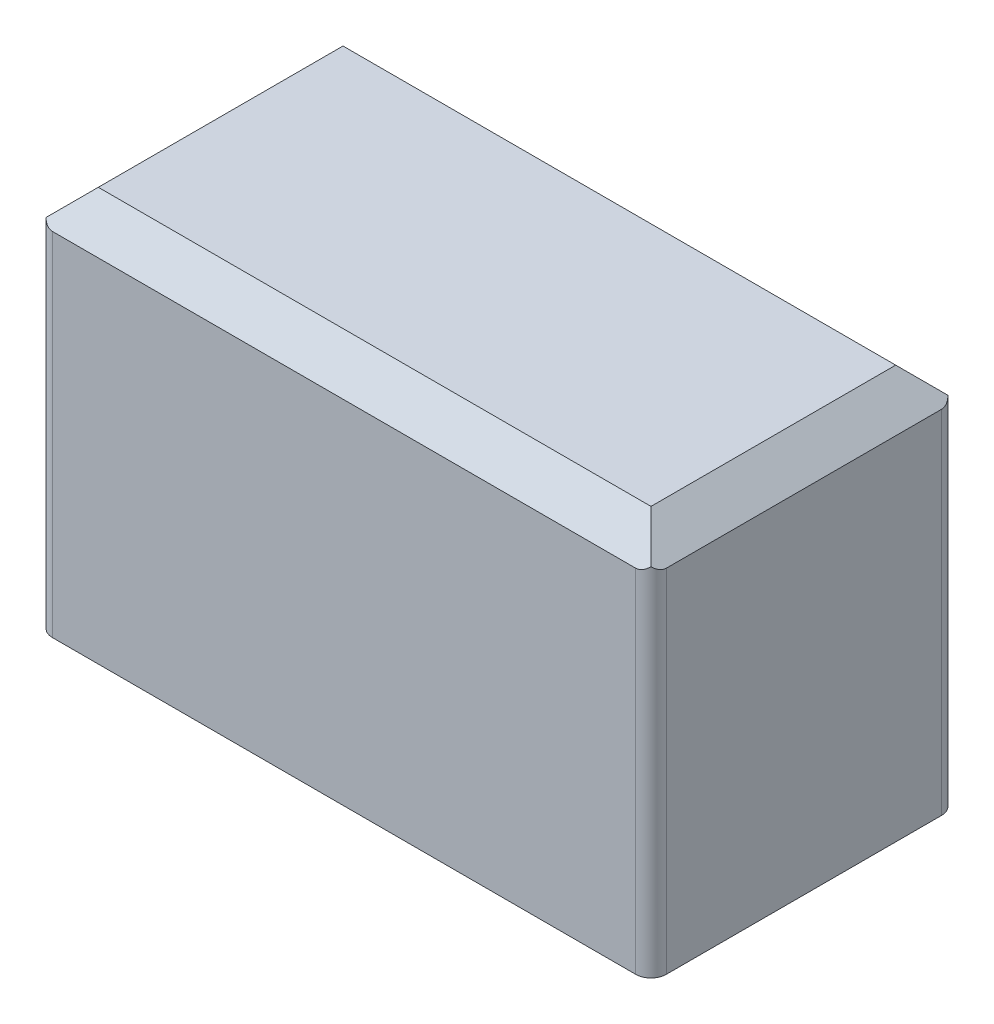
from build123d import *

# Parameters (mm, degrees)
SKETCH1_W           = 52
SKETCH1_H           = 20
BOSS_EXTRUDE1_DEPTH = 25
CHAMFER1_SIZE       = 2
FILLET1_R           = 1
SKETCH2_W           = 11.974527316
SKETCH2_H           = 20.695057274
CUT_EXTRUDE1_DEPTH  = 40
FILLET2_R           = 1
CHAMFER5_SIZE       = 2


with BuildPart() as part:
    # Sketch1 → Boss-Extrude1 (new body)
    with BuildSketch(Plane(origin=(0, 0, 0), x_dir=(1, 0, 0), z_dir=(0, 1, 0))):
        with Locations((26, 10)):
            Rectangle(SKETCH1_W, SKETCH1_H)
    extrude(amount=BOSS_EXTRUDE1_DEPTH)

    # Chamfer1
    chamfer1_edges = [part.edges().sort_by_distance(p)[0] for p in [
        (52, 25, -10),
        (26, 25, -20),
        (0, 25, -10),
        (26, 25, 0),
    ]]
    chamfer(chamfer1_edges, length=CHAMFER1_SIZE)

    # Fillet1
    fillet1_edges = [part.edges().sort_by_distance(p)[0] for p in [
        (0, 11.5, -20),
        (52, 11.5, -20),
        (52, 11.5, 0),
        (0, 11.5, 0),
    ]]
    fillet(fillet1_edges, radius=FILLET1_R)

    # Sketch2 → Cut-Extrude1 (cut)
    with BuildSketch(Plane.XZ):
        with Locations((46.127047968, -10.347528637)):
            Rectangle(SKETCH2_W, SKETCH2_H)
    extrude(amount=-CUT_EXTRUDE1_DEPTH, mode=Mode.SUBTRACT)

    # Fillet2
    fillet2_edges = [part.edges().sort_by_distance(p)[0] for p in [
        (40.13978431, 11.5, -20),
        (40.13978431, 11.5, 0),
    ]]
    fillet(fillet2_edges, radius=FILLET2_R)

    # Chamfer5
    # the kernel refuses this chamfer: 2 mm, written as the material it takes off along each edge
    with BuildSketch(Plane(origin=(40.13978431, 25, 3.143365976), x_dir=(0.027495876610585647, -0.9996219169112968, 0), z_dir=(0, 0, -1))) as chamfer5_piece_1:
        Polygon((CHAMFER5_SIZE * 0.999621916911, CHAMFER5_SIZE * 0.0274958766106), (-CHAMFER5_SIZE * 0.0274958766106, CHAMFER5_SIZE * 0.999621916911), (0, 0), align=None)
    extrude(amount=26.286731952, mode=Mode.SUBTRACT)


solid = part.part
